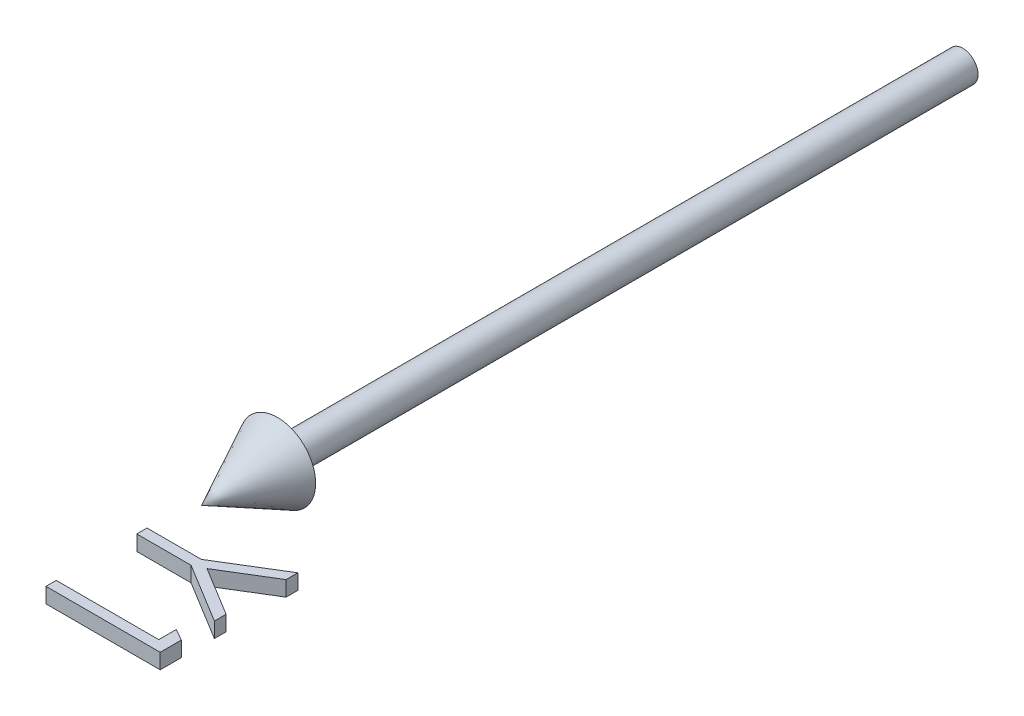
from build123d import *

# Parameters (mm, degrees)
BOSS_EXTRUDE1_DEPTH        = 1
BOSS_EXTRUDE1_DEPTH_BACK   = 1
BOSS_EXTRUDE1_2_DEPTH      = 1
BOSS_EXTRUDE1_2_DEPTH_BACK = 1


with BuildPart() as part:
    # Sketch2 → Revolve1 (revolve)
    with BuildSketch(Plane(origin=(0, 0, 0), x_dir=(1, 0, 0), z_dir=(0, 1, 0))):
        Polygon((0, -100), (5, -90), (2, -90), (2, 0), (0, 0), align=None)
    revolve(axis=Axis((0, 0, -41.949952025), (0, 0, 1)))


with BuildPart() as body_2:
    # Sketch3 → Boss-Extrude1 (new, two sides: drawn at the far end of the back side and taken through both)
    with BuildSketch(Plane(origin=(0, 0, 0), x_dir=(1, 0, 0), z_dir=(0, 1, 0)).offset(-BOSS_EXTRUDE1_DEPTH_BACK)):
        Polygon((15, -102.339799406), (15, -103.881265752), (8.5546875, -107.823573444), (15, -111.759871521), (15, -113.301337867), (7.130408654, -108.49364556), (0, -108.49364556), (0, -107.147491713), (7.130408654, -107.147491713), align=None)
    extrude(amount=BOSS_EXTRUDE1_DEPTH + BOSS_EXTRUDE1_DEPTH_BACK)


with BuildPart() as body_3:
    # Sketch3 → Boss-Extrude1 2 (new, two sides: drawn at the far end of the back side and taken through both)
    with BuildSketch(Plane(origin=(0, 0, 0), x_dir=(1, 0, 0), z_dir=(0, 1, 0)).offset(-BOSS_EXTRUDE1_2_DEPTH_BACK)):
        Polygon((15, -117.643284983), (15, -120.416722483), (0, -120.416722483), (0, -119.070568637), (13.461538462, -119.070568637), (13.461538462, -116.762876329), align=None)
    extrude(amount=BOSS_EXTRUDE1_2_DEPTH + BOSS_EXTRUDE1_2_DEPTH_BACK)


solid = Compound([part.part, body_2.part, body_3.part])
